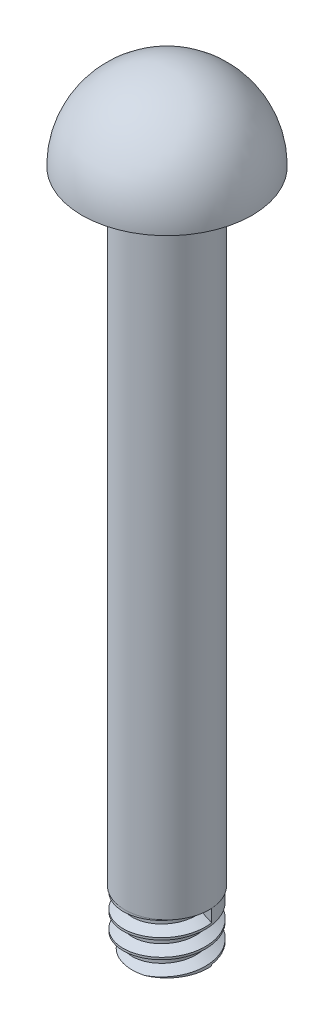
from build123d import *

# Parameters (mm, degrees)
SKETCH2_R           = 12.4
BOSS_EXTRUDE1_DEPTH = 183
SKETCH3_R           = 25
BOSS_EXTRUDE2_DEPTH = 25
FILLET1_R           = 25
SKETCH4_R           = 12.1
BOSS_EXTRUDE3_DEPTH = 15
THREAD2_PITCH       = 5


with BuildPart() as part:
    # Sketch2 → Boss-Extrude1 (new body)
    with BuildSketch(Plane(origin=(0, 0, 0), x_dir=(1, 0, 0), z_dir=(0, 1, 0))):
        with Locations(Location((0, 0, 0), (0, 0, 270))):
            Circle(SKETCH2_R)
    extrude(amount=BOSS_EXTRUDE1_DEPTH)

    # Sketch3 → Boss-Extrude2 (add)
    with BuildSketch(Plane(origin=(0, 183, 0), x_dir=(1, 0, 0), z_dir=(0, 1, 0))):
        with Locations(Location((0, 0, 0), (0, 0, 270))):
            Circle(SKETCH3_R)
    extrude(amount=BOSS_EXTRUDE2_DEPTH)

    # Fillet1
    fillet1_edges = [part.edges().sort_by_distance(p)[0] for p in [
        (0, 208, -25),
    ]]
    fillet(fillet1_edges, radius=FILLET1_R - 0.0001)  # a hair under: the kernel refuses the full size

    # Sketch4 → Boss-Extrude3 (add)
    with BuildSketch(Plane.XZ):
        with Locations(Location((0, 0, 0), (0, 0, 90))):
            Circle(SKETCH4_R)
    extrude(amount=BOSS_EXTRUDE3_DEPTH)

    # Thread2: the profile of Thread Profile3 profile screwed along a right-hand helix of 3 turns, 12 arcs to a turn; built about Z, then put on its axis
    thread2_z = Axis((0, 0, 0), (0, 0, 1))
    thread2_corners = [(12.1003, -3e-09, -0.000173205), (12.1003, -3e-09, 4.375173191), (9.393670625, -2e-09, 2.812499993), (9.393670625, -2e-09, 1.562499993)]
    with BuildLine(mode=Mode.PRIVATE) as thread2_profile:
        Line(thread2_corners[0], thread2_corners[1])
        Line(thread2_corners[1], thread2_corners[2])
        Line(thread2_corners[2], thread2_corners[3])
        Line(thread2_corners[3], thread2_corners[0])
    thread2_cap = Face(thread2_profile.wire())
    thread2_turn_angles = [0, 15, 30, 45, 60, 75, 90, 105, 120, 135, 150, 165, 180, 195, 210, 225, 240, 255, 270, 285, 300, 315, 330, 345, 360]
    thread2_turn_weights = [1, 0.9659258262890683, 1, 0.9659258262890683, 1, 0.9659258262890683, 1, 0.9659258262890683, 1, 0.9659258262890683, 1, 0.9659258262890683, 1, 0.9659258262890683, 1, 0.9659258262890683, 1, 0.9659258262890683, 1, 0.9659258262890683, 1, 0.9659258262890683, 1, 0.9659258262890683, 1]
    thread2_turn_rails = [Edge.make_bspline([Vector(p[0], p[1], 0).rotate(thread2_z, thread2_turn_angles[k]) / thread2_turn_weights[k] + Vector(0, 0, p[2] + THREAD2_PITCH * thread2_turn_angles[k] / 360) for k in range(25)], [0, 0, 0, 1, 1, 2, 2, 3, 3, 4, 4, 5, 5, 6, 6, 7, 7, 8, 8, 9, 9, 10, 10, 11, 11, 12, 12, 12], 2, thread2_turn_weights) for p in thread2_corners]
    thread2_turn_sides = [Face.make_surface_from_curves(thread2_turn_rails[p[0]], thread2_turn_rails[p[1]]) for p in [(0, 1), (1, 2), (2, 3), (3, 0)]]
    thread2 = Plane(origin=(0, -19, 0), x_dir=(0.996194698, 0, -0.087155743), z_dir=(0, 1, 0)) * Solid(Shell([*[p.moved(Location((0, 0, THREAD2_PITCH * i))) for i in range(3) for p in thread2_turn_sides], thread2_cap, thread2_cap.rotate(thread2_z, 1080).moved(Location((0, 0, THREAD2_PITCH * 1080 / 360)))]))
    add(thread2, mode=Mode.SUBTRACT)


solid = part.part
